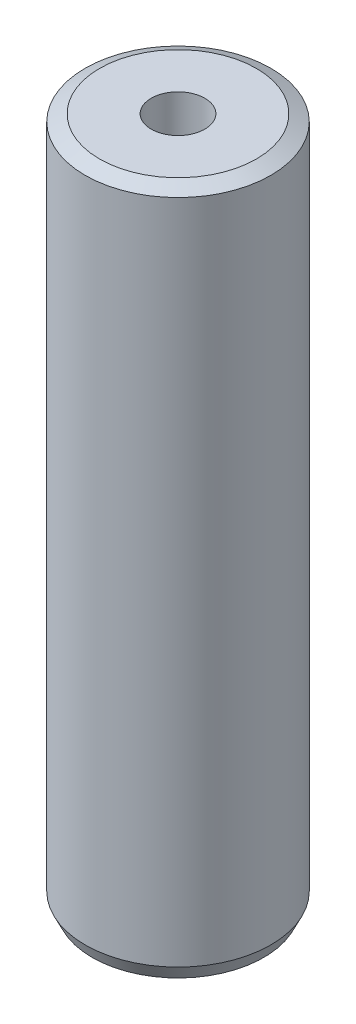
from build123d import *
from OCP.BRepFilletAPI import BRepFilletAPI_MakeChamfer

# Parameters (mm, degrees)
SKETCH1_R           = 12.5
BOSS_EXTRUDE1_DEPTH = 92.630862453
SKETCH2_R           = 3.611542543
CUT_EXTRUDE1_DEPTH  = 95.302580446
CHAMFER1_SIZE       = 0.942561161
CHAMFER1_SIZE2      = 1.936241411


with BuildPart() as part:
    # Sketch1 → Boss-Extrude1 (new body)
    with BuildSketch(Plane(origin=(0, 0, 0), x_dir=(1, 0, 0), z_dir=(0, 1, 0))):
        Circle(SKETCH1_R)
    extrude(amount=BOSS_EXTRUDE1_DEPTH)

    # Sketch2 → Cut-Extrude1 (cut, through all)
    with BuildSketch(Plane(origin=(0, 0, 0), x_dir=(1, 0, 0), z_dir=(0, 1, 0))):
        Circle(SKETCH2_R)
    extrude(amount=CUT_EXTRUDE1_DEPTH, mode=Mode.SUBTRACT)

    # Chamfer1: one chamfer whose edges measure the first distance from different faces: ONE call of the kernel's chamfer builder (chamfer() names one face for all edges)
    chamfer1_edges_1 = [part.edges().sort_by_distance(p)[0] for p in [
        (-12.5, 92.630862453, 0),
    ]]
    chamfer1_side_1 = [part.faces().sort_by_distance(p)[0] for p in [
        (-12.5, 46.315431227, 0),
    ]]
    chamfer1_edges_2 = [part.edges().sort_by_distance(p)[0] for p in [
        (-12.5, 0, 0),
    ]]
    chamfer1_side_2 = [part.faces().sort_by_distance(p)[0] for p in [
        (-12.146446609, 0, 0),
    ]]
    chamfer1 = BRepFilletAPI_MakeChamfer(part.part.solid().wrapped)
    for e in chamfer1_edges_1:
        chamfer1.Add(CHAMFER1_SIZE, CHAMFER1_SIZE2, e.wrapped, chamfer1_side_1[0].wrapped)  # the first distance lies on this face
    for e in chamfer1_edges_2:
        chamfer1.Add(CHAMFER1_SIZE, CHAMFER1_SIZE2, e.wrapped, chamfer1_side_2[0].wrapped)  # the first distance lies on this face
    add(Compound.cast(chamfer1.Shape()), mode=Mode.REPLACE)


solid = part.part
